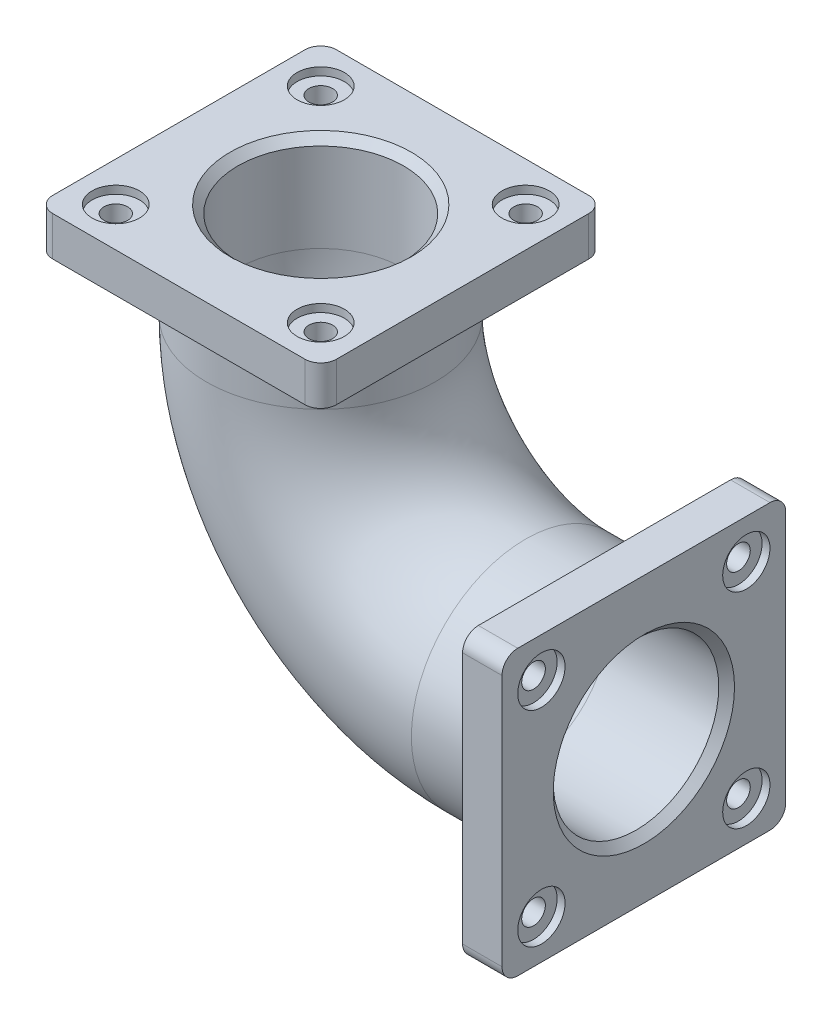
from build123d import *

# Parameters (mm, degrees)
SKETCH2_R                 = 145
SKETCH2_R_2               = 105
BOSS_EXTRUDE1_START       = -50
SKETCH3_W                 = 360
SKETCH3_H                 = 360
SKETCH3_R                 = 145
BOSS_EXTRUDE1_DEPTH       = 50
FILLET1_R                 = 20
SKETCH4_R                 = 145
BOSS_EXTRUDE2_DEPTH       = 50
SKETCH5_R                 = 30
CUT_EXTRUDE2_DEPTH        = 10
CUT_EXTRUDE3_REACH        = 719.763
SKETCH6_R                 = 15
CIRPATTERN1_COUNT         = 4
SKETCH7_R                 = 30
CUT_EXTRUDE4_DEPTH        = 10
SKETCH8_R                 = 15
CUT_EXTRUDE5_DEPTH        = 829.171628686
CIRPATTERN4_START         = 332.601345058
CIRPATTERN4_OUTLINE_R     = 15
CIRPATTERN4_DEPTH         = 50
CIRPATTERN4_START_2       = 372.601345058
CIRPATTERN4_2_OUTLINE_R   = 30
CIRPATTERN4_2_OUTLINE_R_2 = 15
CIRPATTERN4_2_DEPTH       = 10
CHAMFER1_SIZE             = 10


# Read off the part's stored shape, not the designer's step: CirPattern4
with BuildPart() as part:
    # Sweep-Thin1: sweep along a path in Sketch1
    with BuildLine(Plane.XY) as sweep_thin1_path:
        Line((0, 0), (-150, 0))
        ThreePointArc((-150, 0), (-333.847763109, 76.152236891), (-410, 260))
        Line((-410, 260), (-410, 382.601345058))
    # Sketch2 → Sweep-Thin1 (sweep)
    with BuildSketch(Plane(origin=(0, 0, 0), x_dir=(0, 0, -1), z_dir=(1, 0, 0))):
        Circle(SKETCH2_R)
        Circle(SKETCH2_R_2, mode=Mode.SUBTRACT)
    sweep(path=sweep_thin1_path.line)

    # Sketch3 → Boss-Extrude1 (add)
    with BuildSketch(Plane(origin=(0, 0, 0), x_dir=(0, 0, -1), z_dir=(1, 0, 0)).offset(BOSS_EXTRUDE1_START)):
        Rectangle(SKETCH3_W, SKETCH3_H)
        with Locations(Location((0, 0, 0), (0, 0, 270))):
            Circle(SKETCH3_R, mode=Mode.SUBTRACT)
    extrude(amount=BOSS_EXTRUDE1_DEPTH)

    # Fillet1
    fillet1_edges = [part.edges().sort_by_distance(p)[0] for p in [
        (-25, -180, -180),
        (-25, -180, 180),
        (-25, 180, 180),
        (-25, 180, -180),
    ]]
    fillet(fillet1_edges, radius=FILLET1_R)

    # Sketch4 → Boss-Extrude2 (add)
    with BuildSketch(Plane(origin=(0, 382.601345058, 0), x_dir=(1, 0, 0), z_dir=(0, 1, 0))):
        with BuildLine():
            Line((-570, -180), (-250, -180))
            ThreePointArc((-250, -180), (-235.857864376, -174.142135624), (-230, -160))
            Line((-230, -160), (-230, 160))
            ThreePointArc((-230, 160), (-235.857864376, 174.142135624), (-250, 180))
            Line((-250, 180), (-570, 180))
            ThreePointArc((-570, 180), (-584.142135624, 174.142135624), (-590, 160))
            Line((-590, 160), (-590, -160))
            ThreePointArc((-590, -160), (-584.142135624, -174.142135624), (-570, -180))
        make_face()
        with Locations(Location((-410, 0, 0), (0, 0, 180))):
            Circle(SKETCH4_R, mode=Mode.SUBTRACT)
    extrude(amount=-BOSS_EXTRUDE2_DEPTH)

    # Sketch5 → Cut-Extrude2 (cut)
    with BuildSketch(Plane(origin=(0, 0, 0), x_dir=(0, 0, -1), z_dir=(1, 0, 0))):
        with Locations((-130, 130)):
            Circle(SKETCH5_R)
    cut_extrude2 = extrude(amount=-CUT_EXTRUDE2_DEPTH, mode=Mode.SUBTRACT)

    # Sketch6 → Cut-Extrude3 (cut, up to next)
    with BuildSketch(Plane(origin=(-10, 0, 0), x_dir=(0, 0, -1), z_dir=(1, 0, 0)), mode=Mode.PRIVATE) as cut_extrude3_sk1:
        with Locations((-130, 130)):
            Circle(SKETCH6_R)
    cut_extrude3_tool1 = extrude(cut_extrude3_sk1.sketch, amount=-CUT_EXTRUDE3_REACH, mode=Mode.PRIVATE) & part.part
    cut_extrude3 = cut_extrude3_tool1.solids().sort_by_distance((-10, 130, 130))[0]
    add(cut_extrude3, mode=Mode.SUBTRACT)

    # CirPattern1: Cut-Extrude2, Cut-Extrude3 ×4 about axis
    cirpattern1_axis = Axis((0, 0, 0), (1, 0, 0))
    add([cut_extrude2.rotate(cirpattern1_axis, i * 360 / CIRPATTERN1_COUNT) for i in range(1, CIRPATTERN1_COUNT)], mode=Mode.SUBTRACT)
    add([cut_extrude3.rotate(cirpattern1_axis, i * 360 / CIRPATTERN1_COUNT) for i in range(1, CIRPATTERN1_COUNT)], mode=Mode.SUBTRACT)

    # Sketch7 → Cut-Extrude4 (cut)
    with BuildSketch(Plane(origin=(0, 382.601345058, 0), x_dir=(1, 0, 0), z_dir=(0, 1, 0))):
        with Locations(Location((-540, -130, 0), (0, 0, 180))):
            Circle(SKETCH7_R)
    extrude(amount=-CUT_EXTRUDE4_DEPTH, mode=Mode.SUBTRACT)

    # Sketch8 → Cut-Extrude5 (cut, through all)
    with BuildSketch(Plane(origin=(0, 372.601345058, 0), x_dir=(1, 0, 0), z_dir=(0, 1, 0))):
        with Locations(Location((-540, -130, 0), (0, 0, 180))):
            Circle(SKETCH8_R)
    extrude(amount=-CUT_EXTRUDE5_DEPTH, mode=Mode.SUBTRACT)

    # CirPattern4 outline → CirPattern4 (cut)
    with BuildSketch(Plane(origin=(0, 0, 0), x_dir=(1, 0, 0), z_dir=(0, 1, 0)).offset(CIRPATTERN4_START)):
        with Locations((-280, -130)):
            Circle(CIRPATTERN4_OUTLINE_R)
        with Locations((-280, 130)):
            Circle(CIRPATTERN4_OUTLINE_R)
        with Locations((-540, 130)):
            Circle(CIRPATTERN4_OUTLINE_R)
    extrude(amount=CIRPATTERN4_DEPTH, mode=Mode.SUBTRACT)

    # CirPattern4 2 outline → CirPattern4 2 (cut)
    # profile 1 of 3: a face of its own
    with BuildSketch(Plane(origin=(0, 0, 0), x_dir=(1, 0, 0), z_dir=(0, 1, 0)).offset(CIRPATTERN4_START_2)):
        with Locations((-280, -130)):
            Circle(CIRPATTERN4_2_OUTLINE_R)
        with Locations((-280, -130)):
            Circle(CIRPATTERN4_2_OUTLINE_R_2, mode=Mode.SUBTRACT)
    # profile 2 of 3: a face of its own
    with BuildSketch(Plane(origin=(0, 0, 0), x_dir=(1, 0, 0), z_dir=(0, 1, 0)).offset(CIRPATTERN4_START_2)):
        with Locations((-280, 130)):
            Circle(CIRPATTERN4_2_OUTLINE_R)
        with Locations((-280, 130)):
            Circle(CIRPATTERN4_2_OUTLINE_R_2, mode=Mode.SUBTRACT)
    # profile 3 of 3: a face of its own
    with BuildSketch(Plane(origin=(0, 0, 0), x_dir=(1, 0, 0), z_dir=(0, 1, 0)).offset(CIRPATTERN4_START_2)):
        with Locations((-540, 130)):
            Circle(CIRPATTERN4_2_OUTLINE_R)
        with Locations((-540, 130)):
            Circle(CIRPATTERN4_2_OUTLINE_R_2, mode=Mode.SUBTRACT)
    extrude(amount=CIRPATTERN4_2_DEPTH, mode=Mode.SUBTRACT)

    # Chamfer1
    chamfer1_edges = [part.edges().sort_by_distance(p)[0] for p in [
        (0, 0, 105),
        (-410, 382.601345058, 105),
    ]]
    chamfer(chamfer1_edges, length=CHAMFER1_SIZE)


solid = part.part
